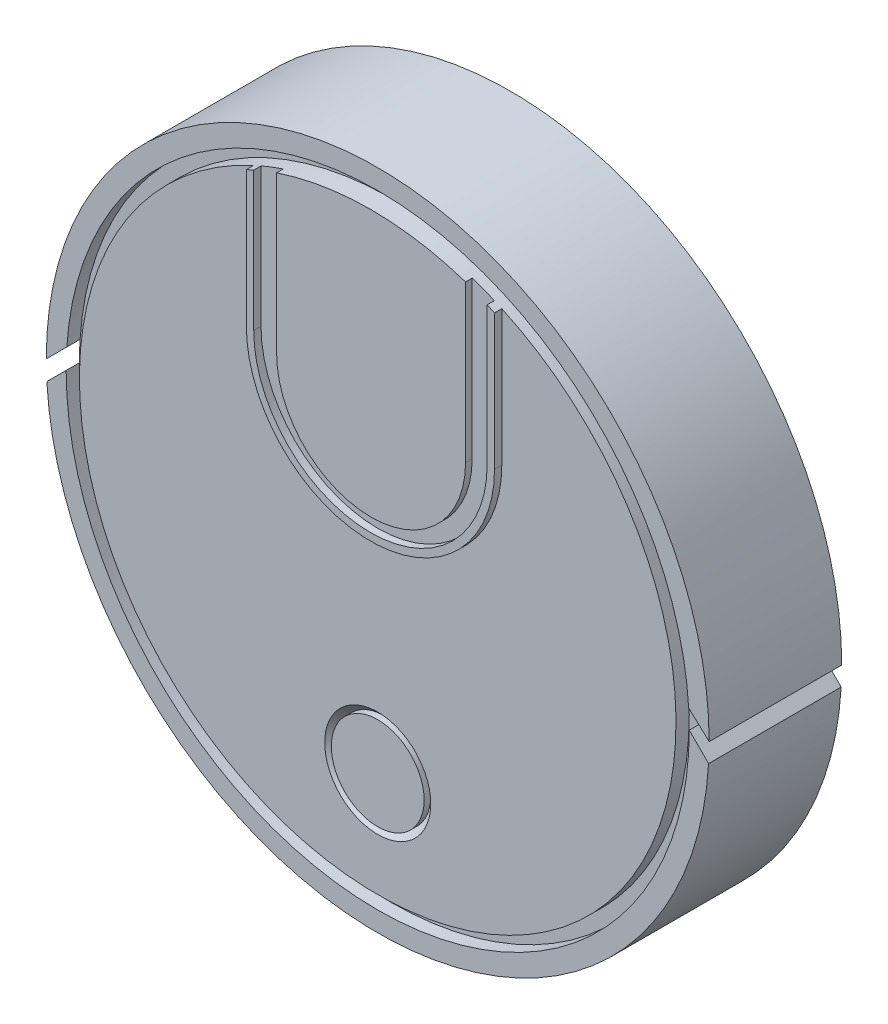
from build123d import *

# Parameters (mm, degrees)
BOSS_EXTRUDE1_DEPTH      = 20
BOSS_EXTRUDE1_2_DEPTH    = 20
SKETCH2_R                = 47
BOSS_EXTRUDE2_DEPTH      = 18
SKETCH3_R                = 45
BOSS_EXTRUDE3_DEPTH      = 2
SKETCH4_R                = 7
CUT_EXTRUDE1_DEPTH       = 1
CHAMFER1_SIZE            = 1
BOSS_EXTRUDE4_START      = 1
SKETCH5_R                = 7
BOSS_EXTRUDE4_DEPTH      = 1
BOSS_EXTRUDE5_DEPTH      = 1
BOSS_EXTRUDE6_DEPTH      = 0.1
BOSS_EXTRUDE6_DEPTH_BACK = 1


with BuildPart() as part:
    # Sketch1 → Boss-Extrude1 (new body)
    with BuildSketch(Plane.XY):
        with BuildLine():
            Line((47, 0), (49.914957884, -2.914957884))
            ThreePointArc((49.914957884, -2.914957884), (0, -50), (-49.914957884, -2.914957884))
            Line((-49.914957884, -2.914957884), (-47, 0))
            ThreePointArc((-47, 0), (0, -47), (47, 0))
        make_face()
    extrude(amount=BOSS_EXTRUDE1_DEPTH)



with BuildPart() as body_2:
    # Sketch1 → Boss-Extrude1 2 (new body)
    with BuildSketch(Plane.XY):
        with BuildLine():
            Line((50, 0), (46.913413371, 2.851604096))
            ThreePointArc((46.913413371, 2.851604096), (0.125706164, 46.999831893), (-46.89748844, 3.10251156))
            Line((-46.89748844, 3.10251156), (-50, 0))
            ThreePointArc((-50, 0), (0, 50), (50, 0))
        make_face()
    extrude(amount=BOSS_EXTRUDE1_2_DEPTH)


with BuildPart() as part_1:
    add(part.part)

    add(body_2.part)  # Boss-Extrude2 merges body 2
    # Sketch2 → Boss-Extrude2 (add)
    with BuildSketch(Plane.XY):
        Circle(SKETCH2_R)
    extrude(amount=BOSS_EXTRUDE2_DEPTH)

    # Sketch3 → Boss-Extrude3 (add)
    with BuildSketch(Plane.XY.offset(18)):
        Circle(SKETCH3_R)
    extrude(amount=BOSS_EXTRUDE3_DEPTH)

    # Sketch4 → Cut-Extrude1 (cut)
    with BuildSketch(Plane.XY.offset(20)):
        with Locations((0, -29.128438865)):
            Circle(SKETCH4_R)
    extrude(amount=-CUT_EXTRUDE1_DEPTH, mode=Mode.SUBTRACT)

    # Chamfer1
    chamfer1_edges = [part_1.edges().sort_by_distance(p)[0] for p in [
        (-7, -29.128438865, 20),
    ]]
    chamfer(chamfer1_edges, length=CHAMFER1_SIZE - 0.0001)  # a hair under: the kernel refuses the full size

    # Sketch5 → Boss-Extrude4 (add)
    with BuildSketch(Plane.XY.offset(19).offset(BOSS_EXTRUDE4_START)):
        with Locations((0, -29.128438865)):
            Circle(SKETCH5_R)
    extrude(amount=-BOSS_EXTRUDE4_DEPTH)

    # Sketch7 → Boss-Extrude5 (add)
    with BuildSketch(Plane.XY.offset(20)):
        with BuildLine():
            Line((14.249883761, 42.684198631), (14.249883761, 19.069697386))
            ThreePointArc((14.249883761, 19.069697386), (0, 4.819813625), (-14.249883761, 19.069697386))
            Line((-14.249883761, 19.069697386), (-14.249883761, 42.684198631))
            ThreePointArc((-14.249883761, 42.684198631), (0, 45), (14.249883761, 42.684198631))
        make_face()
    extrude(amount=BOSS_EXTRUDE5_DEPTH)

    # Sketch8 → Boss-Extrude6 (add, two sides: drawn at the far end of the back side and taken through both)
    with BuildSketch(Plane.XY.offset(21).offset(-BOSS_EXTRUDE6_DEPTH_BACK)):
        with BuildLine():
            Line((18.72043553, 40.921208359), (18.72043553, 20.466744814))
            ThreePointArc((18.72043553, 20.466744814), (0, 1.746309284), (-18.72043553, 20.466744814))
            Line((-18.72043553, 20.466744814), (-18.72043553, 40.921208359))
            ThreePointArc((-18.72043553, 40.921208359), (-18.1632897, 41.1715303), (-17.602797587, 41.414267072))
            Line((-17.602797587, 41.414267072), (-17.602797587, 20.466744814))
            ThreePointArc((-17.602797587, 20.466744814), (0, 2.863947227), (17.602797587, 20.466744814))
            Line((17.602797587, 20.466744814), (17.602797587, 41.414267072))
            ThreePointArc((17.602797587, 41.414267072), (18.1632897, 41.1715303), (18.72043553, 40.921208359))
        make_face()
    extrude(amount=BOSS_EXTRUDE6_DEPTH + BOSS_EXTRUDE6_DEPTH_BACK)


solid = part_1.part
